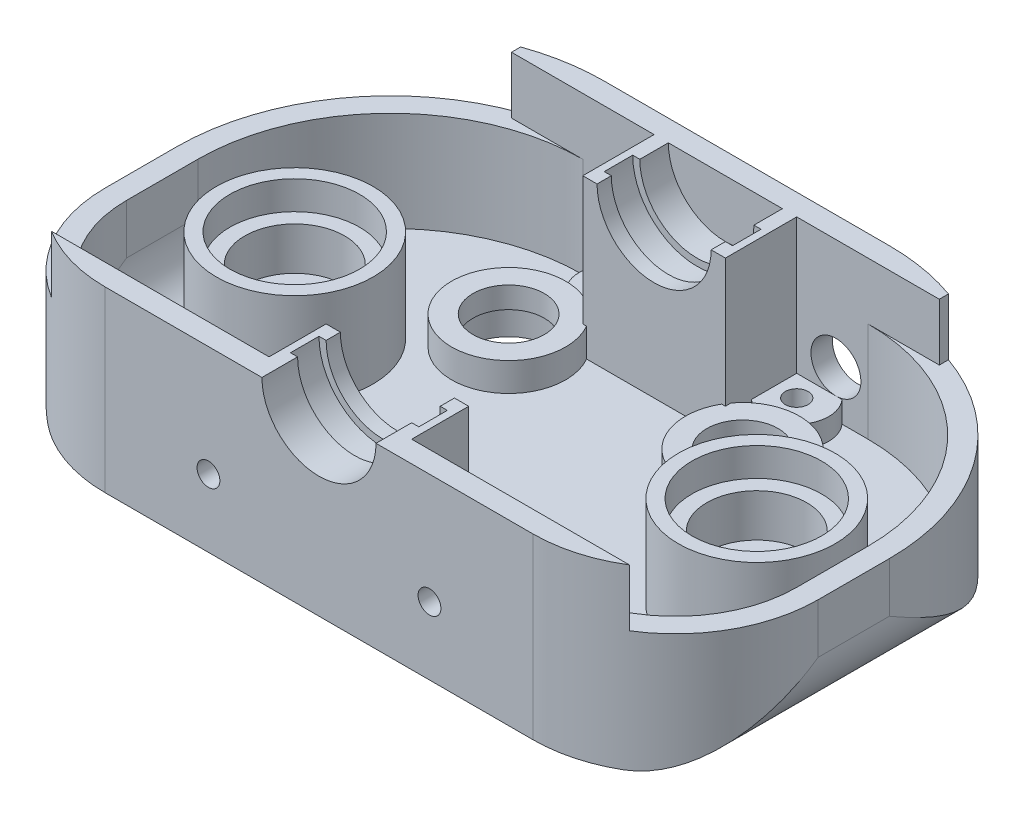
from build123d import *

# Parameters (mm, degrees)
SKETCH_1_W                = 100
SKETCH_1_H                = 60
EXTRUDE_1_DEPTH           = 25
FILLET_2_R                = 10
FILLET_1_R                = 20
FILLET_3_R                = 30
SHELL_1_T                 = -3
CUT_EXTRUDE_1_DEPTH       = 80.837334801
CUT_EXTRUDE_1_DEPTH_BACK  = 80.837334801
SKETCH_2_R                = 1.6
SKETCH_3_W                = 54
SKETCH_3_H                = 10.68528909
CUT_EXTRUDE_2_DEPTH       = 108.354552928
EXTRUDE_3_REACH           = 81.837
SKETCH_5_W                = 20
SKETCH_5_H                = 22
SKETCH_6_W                = 20
SKETCH_6_H                = 36
CUT_EXTRUDE_4_DEPTH       = 22
CUT_EXTRUDE_START         = -57
SKETCH_7_R                = 8
CUT_EXTRUDE_5_DEPTH       = 57
SKETCH_8_R                = 9
CUT_EXTRUDE_6_DEPTH       = 4
SKETCH_9_R                = 9
CUT_EXTRUDE_7_DEPTH       = 4
SKETCH_11_R               = 11
EXTRUDE_4_DEPTH           = 13
SKETCH_12_R               = 9.1
CUT_EXTRUDE_8_DEPTH       = 4
SKETCH_13_R               = 7
CUT_EXTRUDE_9_DEPTH       = 6
SKETCH_14_R               = 4.5
EXTRUDE_6_DEPTH           = 3
SKETCH_16_R               = 1.6
CUT_EXTRUDE_13_DEPTH      = 62.326992601
SKETCH_18_W               = 20
SKETCH_18_H               = 8
CUT_EXTRUDE_15_DEPTH      = 10
SKETCH_20_R               = 1.6
CUT_EXTRUDE_16_DEPTH      = 10
SKETCH_21_R               = 8
EXTRUDE_7_DEPTH           = 7
CUT_EXTRUDE_19_DEPTH      = 62.024585384
CUT_EXTRUDE_19_DEPTH_BACK = 62.024585384
SKETCH_25_R               = 5
SKETCH_26_R               = 6
CUT_EXTRUDE_20_DEPTH      = 4
SKETCH_27_R               = 3.5
CUT_EXTRUDE_21_DEPTH      = 5
SKETCH_17_R               = 3
CUT_EXTRUDE_14_DEPTH      = 3


with BuildPart() as part:
    # 草图1 → 凸台-拉伸1 (new body)
    with BuildSketch(Plane(origin=(0, 0, 0), x_dir=(1, 0, 0), z_dir=(0, 1, 0))):
        Rectangle(SKETCH_1_W, SKETCH_1_H)
    extrude(amount=EXTRUDE_1_DEPTH)

    # 圆角2
    fillet_2_edges = [part.edges().sort_by_distance(p)[0] for p in [
        (-50, 0, 0),
        (50, 0, 0),
    ]]
    fillet(fillet_2_edges, radius=FILLET_2_R)

    # 圆角1
    # the kernel refuses this fillet: 20 mm, written as the material it takes off along each edge
    with BuildSketch(Plane(origin=(50, -40, 30), x_dir=(0, 0, -1), z_dir=(0, 1, 0))) as fillet_1_piece_1:
        with BuildLine():
            CenterArc((FILLET_1_R, FILLET_1_R), FILLET_1_R, 180, 90)
            Line((0, FILLET_1_R), (0, 0))
            Line((0, 0), (FILLET_1_R, 0))
        make_face()
    extrude(amount=115, mode=Mode.SUBTRACT)
    with BuildSketch(Plane(origin=(-50, -40, 30), x_dir=(0, 0, -1), z_dir=(0, 1, 0))) as fillet_1_piece_2:
        with BuildLine():
            CenterArc((FILLET_1_R, -FILLET_1_R), FILLET_1_R, 90, 90)
            Line((0, -FILLET_1_R), (0, 0))
            Line((0, 0), (FILLET_1_R, 0))
        make_face()
    extrude(amount=115, mode=Mode.SUBTRACT)

    # 圆角3
    # the kernel refuses this fillet: 30 mm, written as the material it takes off along each edge
    with BuildSketch(Plane(origin=(50, -65, -30), x_dir=(-1, 0, 0), z_dir=(0, 1, 0))) as fillet_3_piece_1:
        with BuildLine():
            CenterArc((FILLET_3_R, FILLET_3_R), FILLET_3_R, 180, 90)
            Line((0, FILLET_3_R), (0, 0))
            Line((0, 0), (FILLET_3_R, 0))
        make_face()
    extrude(amount=165, mode=Mode.SUBTRACT)
    with BuildSketch(Plane(origin=(-50, -65, -30), x_dir=(1, 0, 0), z_dir=(0, 1, 0))) as fillet_3_piece_2:
        with BuildLine():
            CenterArc((FILLET_3_R, -FILLET_3_R), FILLET_3_R, 90, 90)
            Line((0, -FILLET_3_R), (0, 0))
            Line((0, 0), (FILLET_3_R, 0))
        make_face()
    extrude(amount=165, mode=Mode.SUBTRACT)

    # 抽壳1
    shell_1_openings = [part.faces().sort_by_distance(p)[0] for p in [
        (0, 25, 0.848307379),
    ]]
    offset(amount=SHELL_1_T, openings=shell_1_openings)

    # 草图2 → 切除-拉伸1 (cut, two sides: drawn at the far end of the back side and taken through both)
    with BuildSketch(Plane(origin=(0, 0, 27), x_dir=(-1, 0, 0), z_dir=(0, 0, -1)).offset(-CUT_EXTRUDE_1_DEPTH_BACK)):
        with Locations((-15.5, 9.5)):
            Circle(SKETCH_2_R)
        with Locations((15.5, 9.5)):
            Circle(SKETCH_2_R)
    extrude(amount=CUT_EXTRUDE_1_DEPTH + CUT_EXTRUDE_1_DEPTH_BACK, mode=Mode.SUBTRACT)

    # 草图3 → 切除-拉伸2 (cut, through all)
    with BuildSketch(Plane.ZY.offset(50)):
        with Locations((0, 22.342644545)):
            Rectangle(SKETCH_3_W, SKETCH_3_H)
    extrude(amount=-CUT_EXTRUDE_2_DEPTH, mode=Mode.SUBTRACT)

    # 草图5 → 凸台-拉伸3 (add, up to next)
    with BuildSketch(Plane(origin=(0, 0, 27), x_dir=(-1, 0, 0), z_dir=(0, 0, -1)), mode=Mode.PRIVATE) as extrude_3_sk1:
        with Locations((0, 14)):
            Rectangle(SKETCH_5_W, SKETCH_5_H)
    extrude_3_tool1 = extrude(extrude_3_sk1.sketch, amount=EXTRUDE_3_REACH, mode=Mode.PRIVATE) - part.part
    add(extrude_3_tool1.solids().sort_by_distance((0, 14, 27))[0])

    # 草图6 → 切除-拉伸4 (cut)
    with BuildSketch(Plane(origin=(0, 25, 0), x_dir=(1, 0, 0), z_dir=(0, 1, 0))):
        with Locations((0, -1)):
            Rectangle(SKETCH_6_W, SKETCH_6_H)
    extrude(amount=-CUT_EXTRUDE_4_DEPTH, mode=Mode.SUBTRACT)

    # 草图7 → 切除-拉伸5 (cut)
    with BuildSketch(Plane.XY.offset(30).offset(CUT_EXTRUDE_START)):
        with Locations((0, 25)):
            Circle(SKETCH_7_R)
    extrude(amount=CUT_EXTRUDE_5_DEPTH, mode=Mode.SUBTRACT)

    # 草图8 → 切除-拉伸6 (cut)
    with BuildSketch(Plane(origin=(0, 0, 25), x_dir=(-1, 0, 0), z_dir=(0, 0, -1))):
        with Locations((0, 25)):
            Circle(SKETCH_8_R)
    extrude(amount=CUT_EXTRUDE_6_DEPTH, mode=Mode.SUBTRACT)

    # 草图9 → 切除-拉伸7 (cut)
    with BuildSketch(Plane.XY.offset(-19)):
        with Locations((0, 25)):
            Circle(SKETCH_9_R)
    extrude(amount=-CUT_EXTRUDE_7_DEPTH, mode=Mode.SUBTRACT)

    # 草图11 → 凸台-拉伸4 (add)
    with BuildSketch(Plane(origin=(0, 3, 0), x_dir=(1, 0, 0), z_dir=(0, 1, 0))):
        with Locations(Location((-32.4, -1, 0), (0, 0, 133.702114437))):
            Circle(SKETCH_11_R)
        with Locations(Location((32.4, -1, 0), (0, 0, 46.297885563))):
            Circle(SKETCH_11_R)
    extrude(amount=EXTRUDE_4_DEPTH)

    # 草图12 → 切除-拉伸8 (cut)
    with BuildSketch(Plane(origin=(0, 16, 0), x_dir=(1, 0, 0), z_dir=(0, 1, 0))):
        with Locations(Location((-32.4, -1, 0), (0, 0, 270))):
            Circle(SKETCH_12_R)
        with Locations(Location((32.4, -1, 0), (0, 0, 270))):
            Circle(SKETCH_12_R)
    extrude(amount=-CUT_EXTRUDE_8_DEPTH, mode=Mode.SUBTRACT)

    # 草图13 → 切除-拉伸9 (cut)
    with BuildSketch(Plane(origin=(0, 12, 0), x_dir=(1, 0, 0), z_dir=(0, 1, 0))):
        with Locations(Location((-32.4, -1, 0), (0, 0, 270))):
            Circle(SKETCH_13_R)
        with Locations(Location((32.4, -1, 0), (0, 0, 270))):
            Circle(SKETCH_13_R)
    extrude(amount=-CUT_EXTRUDE_9_DEPTH, mode=Mode.SUBTRACT)

    # 草图14 → 凸台-拉伸6 (add)
    with BuildSketch(Plane(origin=(0, 3, 0), x_dir=(1, 0, 0), z_dir=(0, 1, 0))):
        with Locations((13, -22)):
            Circle(SKETCH_14_R)
        with Locations((-13, -22)):
            Circle(SKETCH_14_R)
        with Locations((-13, 24)):
            Circle(SKETCH_14_R)
        with Locations((13, 24)):
            Circle(SKETCH_14_R)
    extrude(amount=EXTRUDE_6_DEPTH)

    # 草图16 → 切除-拉伸13 (cut, through all)
    with BuildSketch(Plane(origin=(0, 6, 0), x_dir=(1, 0, 0), z_dir=(0, 1, 0))):
        with Locations(Location((13, -22, 0), (0, 0, 270))):
            Circle(SKETCH_16_R)
        with Locations(Location((-13, -22, 0), (0, 0, 270))):
            Circle(SKETCH_16_R)
        with Locations(Location((-13, 24, 0), (0, 0, 270))):
            Circle(SKETCH_16_R)
        with Locations(Location((13, 24, 0), (0, 0, 270))):
            Circle(SKETCH_16_R)
    extrude(amount=-CUT_EXTRUDE_13_DEPTH, mode=Mode.SUBTRACT)

    # 草图18 → 切除-拉伸15 (cut)
    with BuildSketch(Plane(origin=(0, 0, -30), x_dir=(-1, 0, 0), z_dir=(0, 0, -1))):
        with Locations((-40, 21)):
            Rectangle(SKETCH_18_W, SKETCH_18_H)
        with Locations((40, 21)):
            Rectangle(SKETCH_18_W, SKETCH_18_H)
    extrude(amount=-CUT_EXTRUDE_15_DEPTH, mode=Mode.SUBTRACT)

    # 草图20 → 切除-拉伸16 (cut)
    with BuildSketch(Plane(origin=(0, 6, 0), x_dir=(1, 0, 0), z_dir=(0, 1, 0))):
        with Locations(Location((-32.4, -1, 0), (0, 0, 270))):
            Circle(SKETCH_20_R)
        with Locations(Location((32.4, -1, 0), (0, 0, 270))):
            Circle(SKETCH_20_R)
    extrude(amount=-CUT_EXTRUDE_16_DEPTH, mode=Mode.SUBTRACT)

    # 草图21 → 凸台-拉伸7 (add)
    with BuildSketch(Plane.XZ):
        with Locations((16.4, -13)):
            Circle(SKETCH_21_R)
        with Locations((-16.4, -13)):
            Circle(SKETCH_21_R)
    extrude(amount=-EXTRUDE_7_DEPTH)

    # 草图25 → 切除-拉伸19 (cut, two sides: drawn at the far end of the back side and taken through both)
    with BuildSketch(Plane(origin=(0, 7, 0), x_dir=(1, 0, 0), z_dir=(0, 1, 0)).offset(-CUT_EXTRUDE_19_DEPTH_BACK)):
        with Locations(Location((-16.4, 13, 0), (0, 0, 270))):
            Circle(SKETCH_25_R)
        with Locations(Location((16.4, 13, 0), (0, 0, 270))):
            Circle(SKETCH_25_R)
    extrude(amount=CUT_EXTRUDE_19_DEPTH + CUT_EXTRUDE_19_DEPTH_BACK, mode=Mode.SUBTRACT)

    # 草图26 → 切除-拉伸20 (cut)
    with BuildSketch(Plane.XZ):
        with Locations(Location((-16.4, -13, 0), (0, 0, 270))):
            Circle(SKETCH_26_R)
        with Locations(Location((16.4, -13, 0), (0, 0, 270))):
            Circle(SKETCH_26_R)
    extrude(amount=-CUT_EXTRUDE_20_DEPTH, mode=Mode.SUBTRACT)

    # 草图27 → 切除-拉伸21 (cut, symmetric)
    with BuildSketch(Plane(origin=(0, 0, -30), x_dir=(-1, 0, 0), z_dir=(0, 0, -1))):
        with Locations(Location((-15.5, 9.5, 0), (0, 0, 270))):
            Circle(SKETCH_27_R)
        with Locations(Location((15.5, 9.5, 0), (0, 0, 270))):
            Circle(SKETCH_27_R)
    extrude(amount=CUT_EXTRUDE_21_DEPTH, both=True, mode=Mode.SUBTRACT)

    # 草图17 → 切除-拉伸14 (cut)
    with BuildSketch(Plane.XZ):
        with Locations(Location((-13, 22, 0), (0, 0, 270))):
            Circle(SKETCH_17_R)
        with Locations(Location((13, 22, 0), (0, 0, 270))):
            Circle(SKETCH_17_R)
        with Locations(Location((13, -24, 0), (0, 0, 270))):
            Circle(SKETCH_17_R)
        with Locations(Location((-13, -24, 0), (0, 0, 270))):
            Circle(SKETCH_17_R)
        with Locations(Location((-32.4, 1, 0), (0, 0, 270))):
            Circle(SKETCH_17_R)
        with Locations(Location((32.4, 1, 0), (0, 0, 270))):
            Circle(SKETCH_17_R)
    extrude(amount=-CUT_EXTRUDE_14_DEPTH, mode=Mode.SUBTRACT)


solid = part.part
